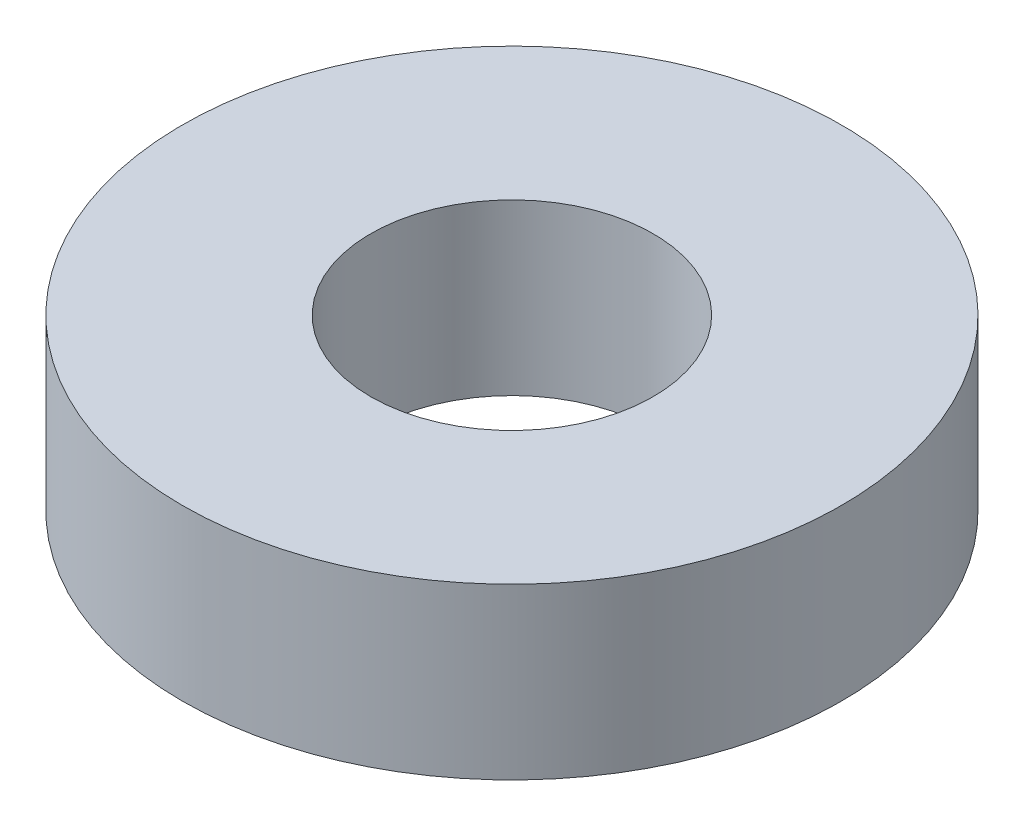
from build123d import *

# Parameters (mm, degrees)
SKETCH1_R           = 35
BOSS_EXTRUDE1_DEPTH = 18
SKETCH2_R           = 15
CUT_EXTRUDE1_DEPTH  = 53.668776329


with BuildPart() as part:
    # Sketch1 → Boss-Extrude1 (new body)
    with BuildSketch(Plane(origin=(0, 0, 0), x_dir=(1, 0, 0), z_dir=(0, 1, 0))):
        Circle(SKETCH1_R)
    extrude(amount=BOSS_EXTRUDE1_DEPTH)

    # Sketch2 → Cut-Extrude1 (cut, through all)
    with BuildSketch(Plane(origin=(0, 0, 0), x_dir=(1, 0, 0), z_dir=(0, 1, 0))):
        Circle(SKETCH2_R)
    extrude(amount=CUT_EXTRUDE1_DEPTH, mode=Mode.SUBTRACT)


solid = part.part
